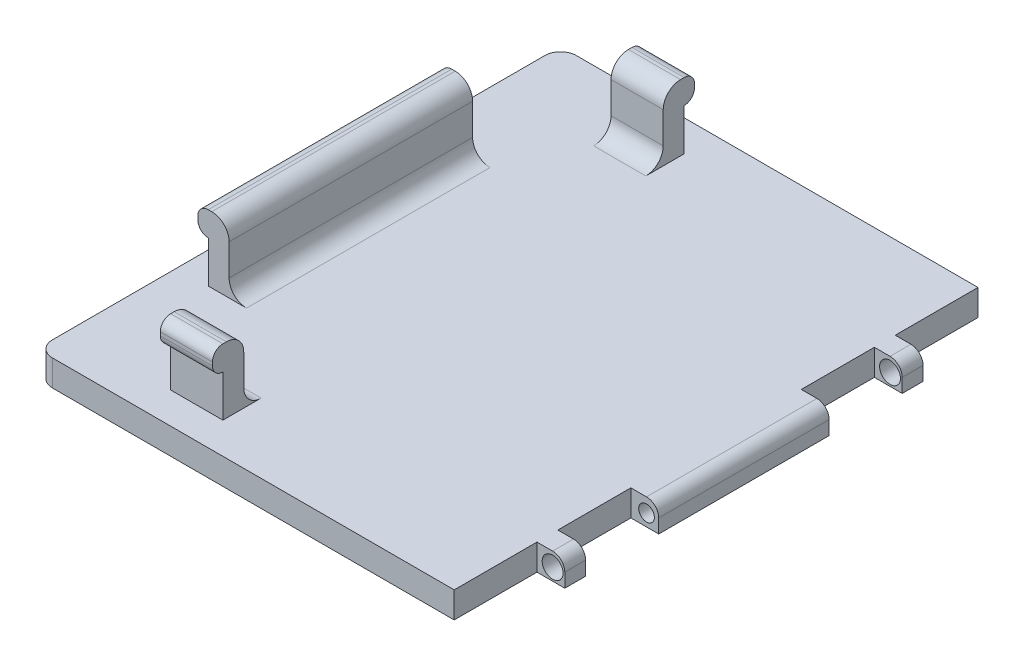
from build123d import *

# Parameters (mm, degrees)
EXTRUDE_START       = 0.25
EXTRUDE_BASE_DEPTH  = 3.75
FILLET1_R           = 1.75
SKETCH2_W           = 4
SKETCH2_H           = 10.5
SKETCH2_H_2         = 11.8971
CUT_EXTRUDE2_DEPTH  = 70.879033956
SKETCH4_R           = 1.5
CUT_EXTRUDE3_DEPTH  = 87.315736962
SKETCH6_W           = 3
SKETCH6_H           = 17.5
SKETCH6_W_2         = 7.5
SKETCH6_H_2         = 3
BOSS_EXTRUDE2_DEPTH = 9.5
SKETCH7_W           = 1.5
SKETCH7_H           = 3.5
BOSS_EXTRUDE3_DEPTH = 35
SKETCH8_W           = 1.5
SKETCH8_H           = 3.5
BOSS_EXTRUDE4_DEPTH = 7.5
SKETCH9_W           = 1.5
SKETCH9_H           = 3.5
BOSS_EXTRUDE5_DEPTH = 7.5
FILLET2_R           = 1.5
FILLET3_R           = 2.5
BOSS_EXTRUDE6_START = -24.5
SKETCH11_R          = 1.5
SKETCH11_R_2        = 1.125
BOSS_EXTRUDE6_DEPTH = 24.5


# Some blends are built 0.0001 mm under size
with BuildPart() as part:
    # Sketch1 → Extrude Base (new body)
    with BuildSketch(Plane.XZ.offset(10.085054916).offset(EXTRUDE_START)):
        with BuildLine():
            Line((56.857940404, 38.199863775), (56.857940404, -32.594336225))
            ThreePointArc((56.857940404, -32.594336225), (56.198930662, -34.185326483), (54.607940404, -34.844336225))
            Line((54.607940404, -34.844336225), (-4.892059596, -34.844336225))
            ThreePointArc((-4.892059596, -34.844336225), (-6.483049854, -34.185326483), (-7.142059596, -32.594336225))
            Line((-7.142059596, -32.594336225), (-7.142059596, 38.199863775))
            ThreePointArc((-7.142059596, 38.199863775), (-6.483049854, 39.790854032), (-4.892059596, 40.449863775))
            Line((-4.892059596, 40.449863775), (54.607940404, 40.449863775))
            ThreePointArc((54.607940404, 40.449863775), (56.198930662, 39.790854032), (56.857940404, 38.199863775))
        make_face()
    extrude(amount=EXTRUDE_BASE_DEPTH)

    # Fillet1
    # the kernel refuses this fillet: 1.75 mm, written as the material it takes off along each edge
    with BuildSketch(Plane(origin=(56.857940404, -10.335054916, 42.574863775), x_dir=(0, -1, 0), z_dir=(0, 0, -1))) as fillet1_piece_1:
        with BuildLine():
            CenterArc((FILLET1_R, FILLET1_R), FILLET1_R, 180, 90)
            Line((0, FILLET1_R), (0, 0))
            Line((0, 0), (FILLET1_R, 0))
        make_face()
    extrude(amount=79.5442, mode=Mode.SUBTRACT)

    # Sketch2 → Cut-Extrude2 (cut, through all)
    with BuildSketch(Plane.XZ.offset(14.085054916)):
        with Locations((54.857940404, 20.302763775)):
            Rectangle(SKETCH2_W, SKETCH2_H)
        with Locations((54.857940404, -14.697236225)):
            Rectangle(SKETCH2_W, SKETCH2_H)
        with Locations((54.857940404, -28.895786225)):
            Rectangle(SKETCH2_W, SKETCH2_H_2)
        with Locations((54.857940404, 34.501313775)):
            Rectangle(SKETCH2_W, SKETCH2_H_2)
    extrude(amount=-CUT_EXTRUDE2_DEPTH, mode=Mode.SUBTRACT)

    # Sketch4 → Cut-Extrude3 (cut, through all)
    with BuildSketch(Plane(origin=(0, 0, -22.947236225), x_dir=(-1, 0, 0), z_dir=(0, 0, -1))):
        with Locations(Location((-55.107940404, -12.335054916, 0), (0, 0, 90))):
            Circle(SKETCH4_R)
    extrude(amount=-CUT_EXTRUDE3_DEPTH, mode=Mode.SUBTRACT)

    # Sketch6 → Boss-Extrude2 (add)
    with BuildSketch(Plane(origin=(0, -10.335054916, 0), x_dir=(1, 0, 0), z_dir=(0, 1, 0))):
        with Locations((-1.142059596, -11.552763775)):
            Rectangle(SKETCH6_W, SKETCH6_H)
        with Locations((-1.142059596, 5.947236225)):
            Rectangle(SKETCH6_W, SKETCH6_H)
        with Locations((11.357940404, 28.844336225)):
            Rectangle(SKETCH6_W_2, SKETCH6_H_2)
        with Locations((11.357940404, -34.449863775)):
            Rectangle(SKETCH6_W_2, SKETCH6_H_2)
    extrude(amount=BOSS_EXTRUDE2_DEPTH)

    # Sketch7 → Boss-Extrude3 (add)
    with BuildSketch(Plane.XY.offset(20.302763775)):
        with Locations((-3.392059596, -2.585054916)):
            Rectangle(SKETCH7_W, SKETCH7_H)
    extrude(amount=-BOSS_EXTRUDE3_DEPTH)

    # Sketch8 → Boss-Extrude4 (add)
    with BuildSketch(Plane(origin=(15.107940404, 0, 0), x_dir=(0, 0, -1), z_dir=(1, 0, 0))):
        with Locations((31.094336225, -2.585054916)):
            Rectangle(SKETCH8_W, SKETCH8_H)
    extrude(amount=-BOSS_EXTRUDE4_DEPTH)

    # Sketch9 → Boss-Extrude5 (add)
    with BuildSketch(Plane(origin=(15.107940404, 0, 0), x_dir=(0, 0, -1), z_dir=(1, 0, 0))):
        with Locations((-36.699863775, -2.585054916)):
            Rectangle(SKETCH9_W, SKETCH9_H)
    extrude(amount=-BOSS_EXTRUDE5_DEPTH)

    # Fillet2
    fillet2_edges = [part.edges().sort_by_distance(p)[0] for p in [
        (11.357940404, -0.835054916, -31.844336225),
        (11.357940404, -4.335054916, -31.844336225),
        (-4.142059596, -0.835054916, 2.802763775),
        (-4.142059596, -4.335054916, 2.802763775),
        (11.357940404, -0.835054916, 37.449863775),
        (11.357940404, -4.335054916, 37.449863775),
    ]]
    fillet(fillet2_edges, radius=FILLET2_R - 0.0001)  # a hair under: the kernel refuses the full size

    # Fillet3
    fillet3_edges = [part.edges().sort_by_distance(p)[0] for p in [
        (0.357940404, -10.335054916, 2.802763775),
        (0.357940404, -0.835054916, 2.802763775),
        (11.357940404, -10.335054916, -27.344336225),
        (11.357940404, -0.835054916, -27.344336225),
        (11.357940404, -0.835054916, 32.949863775),
        (11.357940404, -10.335054916, 32.949863775),
    ]]
    fillet(fillet3_edges, radius=FILLET3_R)

    # Sketch11 → Boss-Extrude6 (add)
    with BuildSketch(Plane.XY.offset(15.052763775).offset(BOSS_EXTRUDE6_START)):
        with Locations(Location((55.107940404, -12.335054916, 0), (0, 0, 90))):
            Circle(SKETCH11_R)
        with Locations((55.107940404, -12.335054916)):
            Circle(SKETCH11_R_2, mode=Mode.SUBTRACT)
    extrude(amount=BOSS_EXTRUDE6_DEPTH)


solid = part.part
